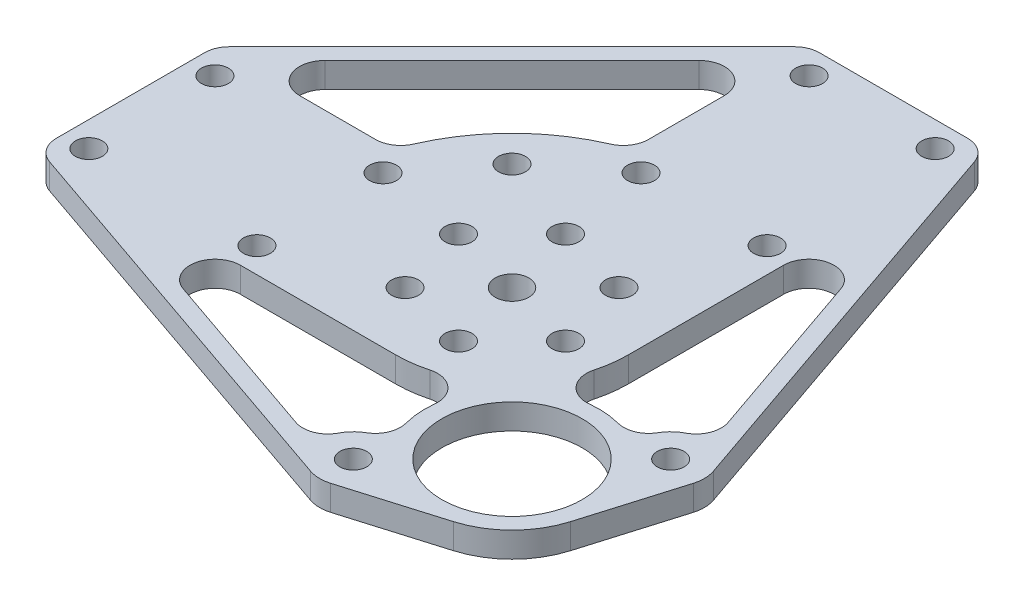
from build123d import *

# Parameters (mm, degrees)
BOSS_EXTRUDE1_DEPTH      = 3
M3_CLEARANCE_HOLE1_D     = 3.2
M3_CLEARANCE_HOLE2_D     = 3.2
F_4_0_4_DIAMETER_HOLE1_D = 4
CUT_EXTRUDE3_DEPTH       = 3
FILLET5_R                = 3
M3_CLEARANCE_HOLE3_D     = 3.2
CUT_EXTRUDE4_START       = -3
CUT_EXTRUDE4_DEPTH       = 3
BOSS_EXTRUDE2_START      = -3
SKETCH17_R               = 8.35
BOSS_EXTRUDE2_DEPTH      = 3
BOSS_EXTRUDE3_START      = -3
BOSS_EXTRUDE3_DEPTH      = 3
M3_CLEARANCE_HOLE4_D     = 3.2
CUT_EXTRUDE5_START       = -3
CUT_EXTRUDE5_DEPTH       = 3
FILLET6_R                = 3
FILLET7_R                = 3


# Some blends are built 0.0001 mm under size
with BuildPart() as part:
    # Sketch2 → Boss-Extrude1 (new body)
    with BuildSketch(Plane(origin=(0, 0, 0), x_dir=(1, 0, 0), z_dir=(0, 1, 0))):
        with BuildLine():
            Line((-16.5, -13.85), (-42.5, -13.85))
            Line((-42.5, -13.85), (-42.5, 7.15))
            Line((-42.5, 7.15), (-24.825, 24.825))
            Line((-24.825, 24.825), (25.724873734, -25.724873734))
            Line((25.724873734, -25.724873734), (16.974873734, -34.474873734))
            ThreePointArc((16.974873734, -34.474873734), (14.482141695, -35.49995444), (12, -34.449489743))
            Line((12, -34.449489743), (12, -39))
            Line((12, -39), (-12, -39))
            Line((-12, -39), (-12, -34.449489743))
            ThreePointArc((-12, -34.449489743), (-17.17260394, -34.259908888), (-16.5, -29.127718677))
            Line((-16.5, -29.127718677), (-16.5, -13.85))
        make_face()
    extrude(amount=BOSS_EXTRUDE1_DEPTH)

    # Mirror5: part across plane


with BuildPart() as part_1:
    add(part.part)
    add(part.part.mirror(Plane(origin=(25.724873734, 3, 25.724873734), x_dir=(0.7071067811865465, 0, 0.7071067811865487), z_dir=(-0.7071067811865486, 0, 0.7071067811865465))))

    # M3 Clearance Hole1 (through all)
    with Locations(Plane(origin=(0, 3, 0), x_dir=(1, 0, 0), z_dir=(0, 1, 0))):
        with Locations((-39.5, 4.15), (-19.5, 4.15), (-19.5, -10.85), (-39.5, -10.85), (-4.15, 19.5), (-4.15, 39.5), (10.85, 39.5), (10.85, 19.5)):
            Hole(M3_CLEARANCE_HOLE1_D / 2)

    # M3 Clearance Hole2 (through all)
    with Locations(Plane(origin=(0, 3, 0), x_dir=(1, 0, 0), z_dir=(0, 1, 0))):
        with Locations((-2.329371406, 8.693332437), (6.363961031, 6.363961031), (8.693332437, -2.329371406), (2.329371406, -8.693332437), (-6.363961031, -6.363961031), (-8.693332437, 2.329371406)):
            Hole(M3_CLEARANCE_HOLE2_D / 2)

    # Ø4.0 (4) Diameter Hole1 (through all)
    with Locations(Plane(origin=(0, 3, 0), x_dir=(1, 0, 0), z_dir=(0, 1, 0))):
        with Locations((0, 0)):
            Hole(F_4_0_4_DIAMETER_HOLE1_D / 2)

    # Sketch13 → Cut-Extrude3 (cut)
    with BuildSketch(Plane(origin=(0, 3, 0), x_dir=(1, 0, 0), z_dir=(0, 1, 0))):
        with BuildLine():
            Line((-39.671572875, 7.15), (-21.333717444, 7.15))
            ThreePointArc((-21.333717444, 7.15), (-19.129970762, 11.844586048), (-15.909902577, 15.909902577))
            Line((-15.909902577, 15.909902577), (-23.410786438, 23.410786438))
            Line((-23.410786438, 23.410786438), (-39.671572875, 7.15))
        make_face()
    cut_extrude3 = extrude(amount=-CUT_EXTRUDE3_DEPTH, mode=Mode.SUBTRACT)

    # Mirror6: Cut-Extrude3 across plane
    add(cut_extrude3.mirror(Plane(origin=(0, -28.792883686, 0), x_dir=(0.7071067811865467, 0, 0.7071067811865482), z_dir=(-0.7071067811865482, 0, 0.7071067811865468))), mode=Mode.SUBTRACT)

    # Fillet5
    fillet5_edges = [part_1.edges().sort_by_distance(p)[0] for p in [
        (-21.333717444, 1.5, -7.15),
        (-39.671572875, 1.5, -7.15),
        (-7.15, 1.5, -21.333717444),
        (-7.15, 1.5, -39.671572875),
    ]]
    fillet(fillet5_edges, radius=FILLET5_R)

    # M3 Clearance Hole3 (through all)
    with Locations(Plane(origin=(0, 3, 0), x_dir=(1, 0, 0), z_dir=(0, 1, 0))):
        with Locations((-12.727922061, 12.727922061)):
            Hole(M3_CLEARANCE_HOLE3_D / 2)

    # Sketch16 → Cut-Extrude4 (cut)
    with BuildSketch(Plane(origin=(0, 3, 0), x_dir=(1, 0, 0), z_dir=(0, 1, 0)).offset(CUT_EXTRUDE4_START)):
        with BuildLine():
            Line((-16.5, -13.85), (-10.493288043, -8.808002387))
            ThreePointArc((-10.493288043, -8.808002387), (9.687362902, -9.687362902), (8.808002387, 10.493288043))
            Line((8.808002387, 10.493288043), (13.85, 16.5))
            Line((13.85, 16.5), (29.127718677, 16.5))
            ThreePointArc((29.127718677, 16.5), (34.259908888, 17.17260394), (34.449489743, 12))
            Line((34.449489743, 12), (39, 12))
            Line((39, 12), (39, -12))
            Line((39, -12), (34.449489743, -12))
            ThreePointArc((34.449489743, -12), (35.49995444, -14.482141695), (34.474873734, -16.974873734))
            Line((34.474873734, -16.974873734), (16.974873734, -34.474873734))
            ThreePointArc((16.974873734, -34.474873734), (14.482141695, -35.49995444), (12, -34.449489743))
            Line((12, -34.449489743), (12, -39))
            Line((12, -39), (-12, -39))
            Line((-12, -39), (-12, -34.449489743))
            ThreePointArc((-12, -34.449489743), (-17.17260394, -34.259908888), (-16.5, -29.127718677))
            Line((-16.5, -29.127718677), (-16.5, -13.85))
        make_face()
    extrude(amount=CUT_EXTRUDE4_DEPTH, mode=Mode.SUBTRACT)

    # Sketch17 → Boss-Extrude2 (add)
    with BuildSketch(Plane(origin=(0, 3, 0), x_dir=(1, 0, 0), z_dir=(0, 1, 0)).offset(BOSS_EXTRUDE2_START)):
        with BuildLine():
            Line((-16.5, -13.85), (13.483684727, -27.139856987))
            ThreePointArc((13.483684727, -27.139856987), (24.996224715, -24.996224715), (27.139856987, -13.483684727))
            Line((27.139856987, -13.483684727), (13.85, 16.5))
            Line((13.85, 16.5), (8.808002387, 10.493288043))
            ThreePointArc((8.808002387, 10.493288043), (9.687362902, -9.687362902), (-10.493288043, -8.808002387))
            Line((-10.493288043, -8.808002387), (-16.5, -13.85))
        make_face()
        with Locations(Location((17.67766953, -17.67766953, 0), (0, 0, 270))):
            Circle(SKETCH17_R, mode=Mode.SUBTRACT)
    extrude(amount=BOSS_EXTRUDE2_DEPTH)

    # Sketch18 → Boss-Extrude3 (add)
    with BuildSketch(Plane(origin=(0, 3, 0), x_dir=(1, 0, 0), z_dir=(0, 1, 0)).offset(BOSS_EXTRUDE3_START)):
        with BuildLine():
            Line((30.898968891, -6.933633811), (13.85, 42.5))
            Line((13.85, 42.5), (13.85, 16.5))
            Line((13.85, 16.5), (27.139856987, -13.483684727))
            ThreePointArc((27.139856987, -13.483684727), (28.006636609, -17.018170416), (27.596413119, -20.634192082))
            Line((27.596413119, -20.634192082), (30.950875914, -9.380411412))
            ThreePointArc((30.950875914, -9.380411412), (31.116645257, -8.152955318), (30.898968891, -6.933633811))
        make_face()
        with BuildLine():
            Line((-42.5, -13.85), (-16.5, -13.85))
            Line((-16.5, -13.85), (13.483684727, -27.139856987))
            ThreePointArc((13.483684727, -27.139856987), (17.018170416, -28.006636609), (20.634192082, -27.596413119))
            Line((20.634192082, -27.596413119), (9.380411412, -30.950875914))
            ThreePointArc((9.380411412, -30.950875914), (8.152955318, -31.116645257), (6.933633811, -30.898968891))
            Line((6.933633811, -30.898968891), (-42.5, -13.85))
        make_face()
    extrude(amount=BOSS_EXTRUDE3_DEPTH)

    # M3 Clearance Hole4 (through all)
    with Locations(Plane(origin=(0, 3, 0), x_dir=(1, 0, 0), z_dir=(0, 1, 0))):
        with Locations((8.237794001, -27.117545059), (27.117545059, -8.237794001)):
            Hole(M3_CLEARANCE_HOLE4_D / 2)

    # Sketch21 → Cut-Extrude5 (cut)
    with BuildSketch(Plane(origin=(0, 3, 0), x_dir=(1, 0, 0), z_dir=(0, 1, 0)).offset(CUT_EXTRUDE5_START)):
        with BuildLine():
            Line((13.85, 36.365784234), (27.878821119, -4.310904805))
            ThreePointArc((27.878821119, -4.310904805), (25.451546124, -4.601250649), (23.646518046, -6.249837391))
            ThreePointArc((23.646518046, -6.249837391), (22.205721923, -7.524489916), (20.286938067, -7.661970967))
            ThreePointArc((20.286938067, -7.661970967), (15.946603087, -7.473459175), (11.911266823, -9.082839698))
            Line((11.911266823, -9.082839698), (11.104995265, -8.27656814))
            ThreePointArc((11.104995265, -8.27656814), (13.145848858, -4.359949288), (13.85, 0))
            Line((13.85, 0), (13.85, 36.365784234))
        make_face()
        with BuildLine():
            Line((0, -13.85), (-36.365784234, -13.85))
            Line((-36.365784234, -13.85), (4.310904805, -27.878821119))
            ThreePointArc((4.310904805, -27.878821119), (4.601250649, -25.451546124), (6.249837391, -23.646518046))
            ThreePointArc((6.249837391, -23.646518046), (7.524489916, -22.205721923), (7.661970967, -20.286938067))
            ThreePointArc((7.661970967, -20.286938067), (7.473459175, -15.946603087), (9.082839698, -11.911266823))
            Line((9.082839698, -11.911266823), (8.27656814, -11.104995265))
            ThreePointArc((8.27656814, -11.104995265), (4.359949288, -13.145848858), (0, -13.85))
        make_face()
    extrude(amount=CUT_EXTRUDE5_DEPTH, mode=Mode.SUBTRACT)

    # Fillet6
    # the kernel refuses this fillet: 3 mm, written as the material it adds along each edge
    with BuildSketch(Plane(origin=(13.85, 0, -36.365784234), x_dir=(0, 0, 1), z_dir=(0, 1, 0)), Plane(origin=(-36.365784234, 0, 13.85), x_dir=(0.945355958029755, 0, 0.3260400475672341), z_dir=(0, 1, 0))) as fillet6_piece_1:
        with BuildLine():
            CenterArc((FILLET6_R * 5.96661659371, FILLET6_R), FILLET6_R, 109.02859786, 160.97140214)
            Line((FILLET6_R * 5.64057654615, FILLET6_R * 1.94535595803), (FILLET6_R * 5.63405574519, FILLET6_R * 1.96426307719))
            Line((FILLET6_R * 5.63405574519, FILLET6_R * 1.96426307719), (-FILLET6_R * 0.00652080095135, FILLET6_R * 0.0189071191606))
            Line((-FILLET6_R * 0.00652080095135, FILLET6_R * 0.0189071191606), (0, -FILLET6_R * 0.02))
            Line((0, -FILLET6_R * 0.02), (FILLET6_R * 5.96661659371, -FILLET6_R * 0.02))
            Line((FILLET6_R * 5.96661659371, -FILLET6_R * 0.02), (FILLET6_R * 5.96661659371, 0))
        make_face()
    extrude(amount=3)
    with BuildSketch(Plane(origin=(27.878821119, 0, 4.310904805), x_dir=(-0.32604004756723476, 0, -0.9453559580297546), z_dir=(0, 1, 0))) as fillet6_piece_2:
        with BuildLine():
            CenterArc((3.464101615, 3), FILLET6_R, 188.213210702, 81.786789298)
            Line((0.494871659, 2.571428571), (0.43548706, 2.562857143))
            ThreePointArc((0.43548706, 2.562857143), (0.404901579, 1.255409988), (-0.051961524, 0.03))
            Line((-0.051961524, 0.03), (0, -0.06))
            Line((0, -0.06), (3.464101615, -0.06))
            Line((3.464101615, -0.06), (3.464101615, 0))
        make_face()
    extrude(amount=3)
    with BuildSketch(Plane(origin=(11.104995265, 0, 8.27656814), x_dir=(0.7071067811869455, 0, 0.7071067811861494), z_dir=(0, 1, 0))) as fillet6_piece_3:
        with BuildLine():
            CenterArc((2.481144361, 2.683649746), FILLET6_R, 196.13857285, 47.312103401)
            Line((-0.400632365, 1.849765518), (-0.458267899, 1.833087834))
            ThreePointArc((-0.458267899, 1.833087834), (-0.227322426, 0.919033599), (-0.059371126, -0.00866426))
            Line((-0.059371126, -0.00866426), (0, -0.06))
            ThreePointArc((0, -0.06), (0.570120087, -0.06), (1.113422089, -0.053672995))
            Line((1.113422089, -0.053672995), (1.140240173, 0))
        make_face()
    extrude(amount=3)
    with BuildSketch(Plane(origin=(8.27656814, 0, 11.104995265), x_dir=(-0.8407620685724203, 0, 0.5414047876125816), z_dir=(0, 1, 0))) as fillet6_piece_4:
        with BuildLine():
            CenterArc((2.097634461, 2.992988969), FILLET6_R, 218.770003629, 47.312103401)
            Line((-0.241363262, 1.114401825), (-0.288143216, 1.076830083))
            ThreePointArc((-0.288143216, 1.076830083), (-0.179322004, 0.544500259), (-0.058640373, -0.012700654))
            Line((-0.058640373, -0.012700654), (0.004099611, -0.059859779))
            ThreePointArc((0.004099611, -0.059859779), (0.946326947, -0.027632406), (1.888554283, -0.059859779))
            Line((1.888554283, -0.059859779), (1.892653895, 0))
        make_face()
    extrude(amount=3)
    with BuildSketch(Plane(origin=(4.310904805, 0, 27.878821119), x_dir=(0.14150948766511262, 0, -0.98993689945408), z_dir=(0, 1, 0))) as fillet6_piece_5:
        with BuildLine():
            CenterArc((3.600595189, 2.834733548), FILLET6_R, 169.106605351, 81.786789298)
            Line((0.654653671, 3.401680257), (0.59573484, 3.413019191))
            Line((0.59573484, 3.413019191), (-0.05891883, 0.011338934))
            Line((-0.05891883, 0.011338934), (0.01963961, -0.056694671))
            ThreePointArc((0.01963961, -0.056694671), (1.309307341, 0.16035527), (2.598975073, -0.056694671))
            Line((2.598975073, -0.056694671), (2.618614683, 0))
        make_face()
    extrude(amount=3)

    # Fillet7
    fillet7_edges = [part_1.edges().sort_by_distance(p)[0] for p in [
        (11.911266823, 1.5, 9.082839698),
        (9.082839698, 1.5, 11.911266823),
        (-42.5, 1.5, -7.15),
        (-7.15, 1.5, -42.5),
        (13.85, 1.5, -42.5),
        (-42.5, 1.5, 13.85),
    ]]
    fillet(fillet7_edges, radius=FILLET7_R - 0.0001)  # a hair under: the kernel refuses the full size


solid = part_1.part
